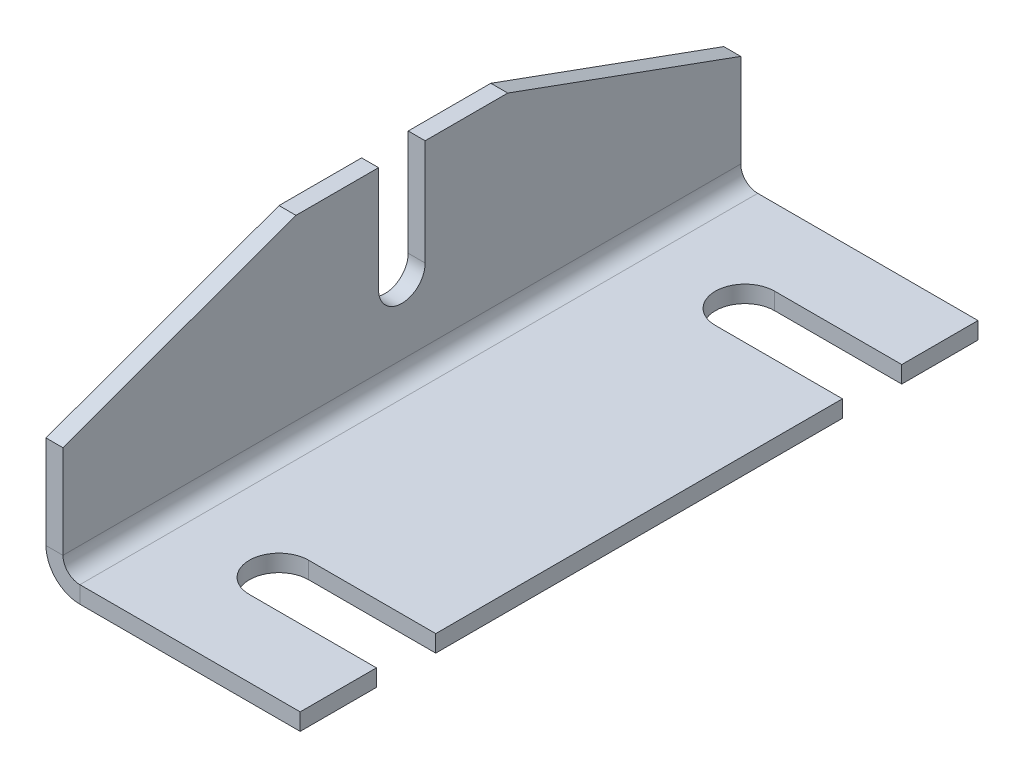
from build123d import *

# Parameters (mm, degrees)
BASE_FLANGE3_DEPTH = 80
CUT_EXTRUDE1_DEPTH = 110.708705215
CUT_EXTRUDE2_DEPTH = 111.072703247


# Sheet-metal steps are written as plain solids
with BuildPart() as part:
    # Sketch1 → Base-Flange3 (new, symmetric)
    with BuildSketch(Plane.XY):
        with BuildLine():
            Line((60, 0), (8, 0))
            ThreePointArc((8, 0), (2.343145751, 2.343145751), (0, 8))
            Line((0, 8), (0, 50))
            Line((0, 50), (4, 50))
            Line((4, 50), (4, 8))
            ThreePointArc((4, 8), (5.171572875, 5.171572875), (8, 4))
            Line((8, 4), (60, 4))
            Line((60, 4), (60, 0))
        make_face()
    extrude(amount=BASE_FLANGE3_DEPTH, both=True)

    # Sketch14 → Cut-Extrude1 (cut, through all)
    with BuildSketch(Plane(origin=(4, 0, 0), x_dir=(0, 0, -1), z_dir=(1, 0, 0))):
        Polygon((-80, 30), (-25, 50), (-80, 50), align=None)
        Polygon((80, 30), (25, 50), (80, 50), align=None)
        with BuildLine():
            Line((-5.5, 50), (-5.5, 25))
            ThreePointArc((-5.5, 25), (0, 19.5), (5.5, 25))
            Line((5.5, 25), (5.5, 50))
            Line((5.5, 50), (-5.5, 50))
        make_face()
    extrude(amount=-CUT_EXTRUDE1_DEPTH, mode=Mode.SUBTRACT)

    # Sketch16 → Cut-Extrude2 (cut, through all)
    with BuildSketch(Plane(origin=(0, 4, 0), x_dir=(1, 0, 0), z_dir=(0, 1, 0))):
        with BuildLine():
            Line((60, 62), (30, 62))
            ThreePointArc((30, 62), (23, 55), (30, 48))
            Line((30, 48), (60, 48))
            Line((60, 48), (60, 62))
        make_face()
        with BuildLine():
            Line((60, -48), (60, -62))
            Line((60, -62), (30, -62))
            ThreePointArc((30, -62), (23, -55), (30, -48))
            Line((30, -48), (60, -48))
        make_face()
    extrude(amount=-CUT_EXTRUDE2_DEPTH, mode=Mode.SUBTRACT)


solid = part.part
